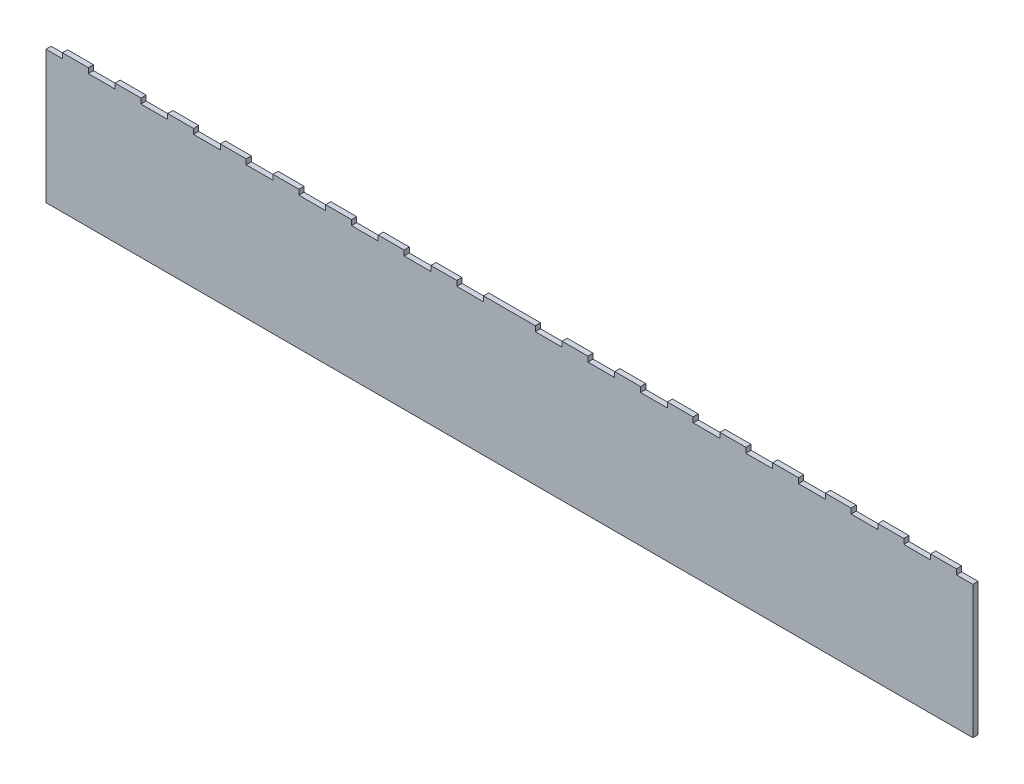
from build123d import *

# Parameters (mm, degrees)
SKETCH1_W           = 537
SKETCH1_H           = 80
BOSS_EXTRUDE1_DEPTH = 3
CAVITY1_START       = 37
CAVITY1_OUTLINE_W   = 15.5
CAVITY1_OUTLINE_H   = 3
CAVITY1_OUTLINE_W_2 = 9.5
CAVITY1_DEPTH       = 3


# Read off the part's stored shape, not the designer's step: Cavity1
with BuildPart() as part:
    # Sketch1 → Boss-Extrude1 (new body)
    with BuildSketch(Plane.XY):
        Rectangle(SKETCH1_W, SKETCH1_H)
    extrude(amount=BOSS_EXTRUDE1_DEPTH)

    # Cavity1 outline → Cavity1 (cut)
    with BuildSketch(Plane(origin=(0, 0, 0), x_dir=(1, 0, 0), z_dir=(0, 1, 0)).offset(CAVITY1_START)):
        with Locations((-236.25, -1.5)):
            Rectangle(CAVITY1_OUTLINE_W, CAVITY1_OUTLINE_H)
        with Locations((-263.75, -1.5)):
            Rectangle(CAVITY1_OUTLINE_W_2, CAVITY1_OUTLINE_H)
        with Locations((-205.75, -1.5)):
            Rectangle(CAVITY1_OUTLINE_W, CAVITY1_OUTLINE_H)
        with Locations((-175.25, -1.5)):
            Rectangle(CAVITY1_OUTLINE_W, CAVITY1_OUTLINE_H)
        with Locations((-144.75, -1.5)):
            Rectangle(CAVITY1_OUTLINE_W, CAVITY1_OUTLINE_H)
        with Locations((-114.25, -1.5)):
            Rectangle(CAVITY1_OUTLINE_W, CAVITY1_OUTLINE_H)
        with Locations((-83.75, -1.5)):
            Rectangle(CAVITY1_OUTLINE_W, CAVITY1_OUTLINE_H)
        with Locations((-53.25, -1.5)):
            Rectangle(CAVITY1_OUTLINE_W, CAVITY1_OUTLINE_H)
        with Locations((-22.75, -1.5)):
            Rectangle(CAVITY1_OUTLINE_W, CAVITY1_OUTLINE_H)
        with Locations((22.75, -1.5)):
            Rectangle(CAVITY1_OUTLINE_W, CAVITY1_OUTLINE_H)
        with Locations((53.25, -1.5)):
            Rectangle(CAVITY1_OUTLINE_W, CAVITY1_OUTLINE_H)
        with Locations((83.75, -1.5)):
            Rectangle(CAVITY1_OUTLINE_W, CAVITY1_OUTLINE_H)
        with Locations((114.25, -1.5)):
            Rectangle(CAVITY1_OUTLINE_W, CAVITY1_OUTLINE_H)
        with Locations((144.75, -1.5)):
            Rectangle(CAVITY1_OUTLINE_W, CAVITY1_OUTLINE_H)
        with Locations((175.25, -1.5)):
            Rectangle(CAVITY1_OUTLINE_W, CAVITY1_OUTLINE_H)
        with Locations((205.75, -1.5)):
            Rectangle(CAVITY1_OUTLINE_W, CAVITY1_OUTLINE_H)
        with Locations((236.25, -1.5)):
            Rectangle(CAVITY1_OUTLINE_W, CAVITY1_OUTLINE_H)
        with Locations((263.75, -1.5)):
            Rectangle(CAVITY1_OUTLINE_W_2, CAVITY1_OUTLINE_H)
    extrude(amount=CAVITY1_DEPTH, mode=Mode.SUBTRACT)


solid = part.part
